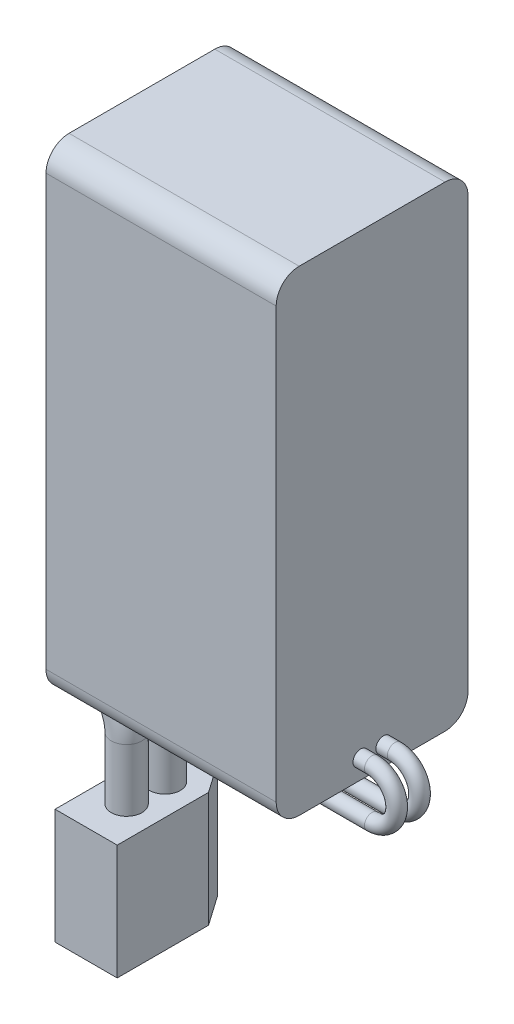
from build123d import *

# Parameters (mm, degrees)
SKETCH1_W           = 62
SKETCH1_H           = 30
BOSS_EXTRUDE1_DEPTH = 25
FILLET1_R           = 3
SKETCH2_R           = 2
SKETCH5_R           = 1
SKETCH7_W           = 3
SKETCH7_H           = 6
BOSS_EXTRUDE2_DEPTH = 3.5
BOSS_EXTRUDE2_TAPER = 3
BOSS_EXTRUDE3_DEPTH = 15


with BuildPart() as part:
    # Sketch1 → Boss-Extrude1 (new body)
    with BuildSketch(Plane(origin=(0, 0, 0), x_dir=(0, 1, 0), z_dir=(0, 0, 1))):
        Rectangle(SKETCH1_W, SKETCH1_H)
    extrude(amount=BOSS_EXTRUDE1_DEPTH)

    # Fillet1
    fillet1_edges = [part.edges().sort_by_distance(p)[0] for p in [
        (0, -31, 0),
        (0, -31, 25),
        (0, 31, 0),
        (0, 31, 25),
    ]]
    fillet(fillet1_edges, radius=FILLET1_R)

    # Sweep2: sweep along a path in Sketch4
    with BuildLine(Plane(origin=(0, 0, 0), x_dir=(0, 1, 0), z_dir=(0, 0, 1))) as sweep2_path:
        Line((-28, 15), (-28, 17.641817009))
        ThreePointArc((-28, 17.641817009), (-30.558167955, 20.670575721), (-33.97216907, 18.655085952))
        ThreePointArc((-33.97216907, 18.655085952), (-36.239159807, 15.640572518), (-39.83271041, 14.494739937))
        Line((-39.83271041, 14.494739937), (-47.929878258, 14.494739937))
    # Sketch2 → Sweep2 (sweep)
    with BuildSketch(Plane(origin=(-15, 0, 10), x_dir=(0, 0, -1), z_dir=(1, 0, 0))):
        with Locations((0, -28)):
            Circle(SKETCH2_R)
        with Locations((-5, -28)):
            Circle(SKETCH2_R)
    sweep(path=sweep2_path.line)

    # Sweep3: sweep along a path in Sketch6
    with BuildLine(Plane(origin=(0, 0, 0), x_dir=(0, 1, 0), z_dir=(0, 0, 1))) as sweep3_path:
        Line((-28.5, -15), (-28.5, -16.497724548))
        ThreePointArc((-28.5, -16.497724548), (-31.700025095, -19.697749643), (-34.900050191, -16.497724548))
        Line((-34.900050191, -16.497724548), (-34.900050191, 6.423160741))
    # Sketch5 → Sweep3 (sweep)
    with BuildSketch(Plane.YZ.offset(15)):
        with Locations((-28.5, 13.991576598)):
            Circle(SKETCH5_R)
        with Locations((-28.5, 11.008423402)):
            Circle(SKETCH5_R)
    sweep(path=sweep3_path.line)

    # Sketch7 → Boss-Extrude2 (add)
    with BuildSketch(Plane(origin=(-6.423160741, 0, 0), x_dir=(0, -1, 0), z_dir=(-1, 0, 0))):
        with Locations((34.900050191, 12.5)):
            Rectangle(SKETCH7_W, SKETCH7_H)
    extrude(amount=BOSS_EXTRUDE2_DEPTH, taper=BOSS_EXTRUDE2_TAPER)

    # Sketch8 → Boss-Extrude3 (add)
    with BuildSketch(Plane.XZ.offset(47.929878258)):
        Polygon((-18.544739937, 8.369128369), (-15.888771627, 4.576012521), (-13.100708247, 4.576012521), (-10.444739937, 8.369128369), (-10.444739937, 20.276012521), (-18.544739937, 20.276012521), align=None)
    extrude(amount=BOSS_EXTRUDE3_DEPTH)


solid = part.part
